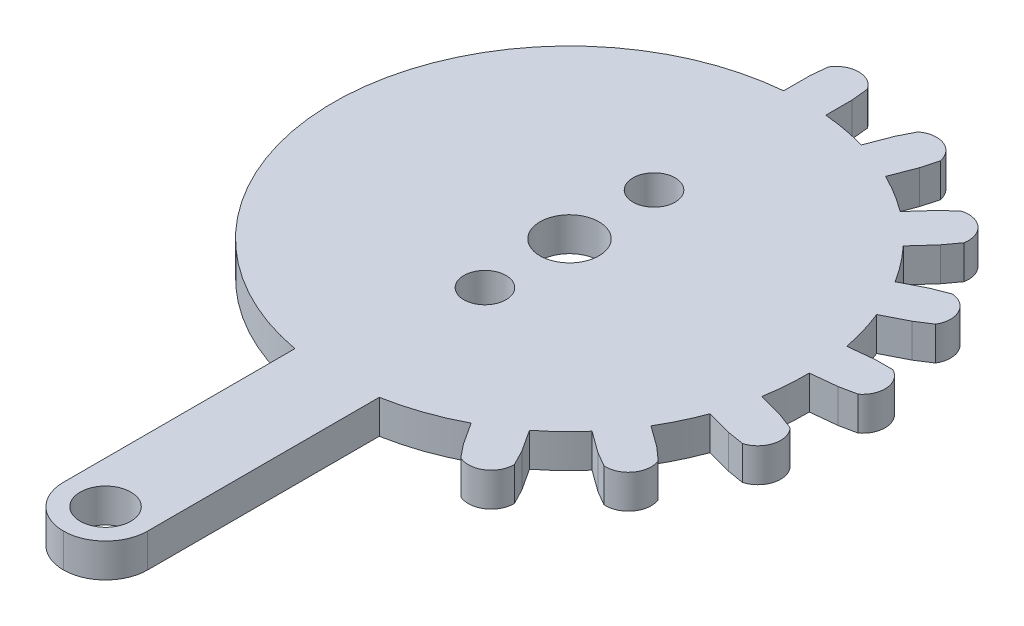
from build123d import *

# Parameters (mm, degrees)
BOSS_EXTRUDE1_DEPTH = 1
SKETCH5_R           = 1.75
SKETCH5_R_2         = 1.25
CUT_EXTRUDE3_DEPTH  = 35.568104475
FILLET1_R           = 2.5
SKETCH6_R           = 1.5
CUT_EXTRUDE4_DEPTH  = 35.568104475


with BuildPart() as part:
    # Sketch1 → Boss-Extrude1 (new, symmetric)
    with BuildSketch(Plane(origin=(0, 0, 0), x_dir=(1, 0, 0), z_dir=(0, 1, 0))):
        with BuildLine():
            Line((1.25, 15.5), (1.15, 16.5))
            ThreePointArc((1.15, 16.5), (0, 17.143895929), (-1.15, 16.5))
            Line((-1.15, 16.5), (-1.25, 15.5))
            Line((-1.25, 15.5), (-1.25, 13.944084767))
            ThreePointArc((-1.25, 13.944084767), (-13.985786559, 0.630693533), (-2.5, -13.774977314))
            Line((-2.5, -13.774977314), (-2.5, -30))
            Line((-2.5, -30), (2.5, -30))
            Line((2.5, -30), (2.5, -13.774977314))
            ThreePointArc((2.5, -13.774977314), (4.576899397, -13.230721519), (6.546154662, -12.375292285))
            Line((6.546154662, -12.375292285), (7.393566833, -13.680192597))
            Line((7.393566833, -13.680192597), (8.022072925, -14.464399261))
            ThreePointArc((8.022072925, -14.464399261), (9.337234935, -14.378080935), (9.951015231, -13.211729481))
            Line((9.951015231, -13.211729481), (9.490243253, -12.318595009))
            Line((9.490243253, -12.318595009), (8.642831082, -11.013694698))
            ThreePointArc((8.642831082, -11.013694698), (9.63696406, -10.155241194), (10.546269982, -9.207398626))
            Line((10.546269982, -9.207398626), (11.805031847, -10.121942654))
            Line((11.805031847, -10.121942654), (12.672827367, -10.628826206))
            ThreePointArc((12.672827367, -10.628826206), (13.869703156, -10.076929194), (14.024733447, -8.768087119))
            Line((14.024733447, -8.768087119), (13.274494978, -8.099400168))
            Line((13.274494978, -8.099400168), (12.015733113, -7.18485614))
            ThreePointArc((12.015733113, -7.18485614), (12.636193981, -6.027155355), (13.145427794, -4.816401987))
            Line((13.145427794, -4.816401987), (14.648326501, -5.219102482))
            Line((14.648326501, -5.219102482), (15.640134232, -5.381328944))
            ThreePointArc((15.640134232, -5.381328944), (16.559731841, -4.437166774), (16.235418036, -3.159699544))
            Line((16.235418036, -3.159699544), (15.295374114, -2.804287916))
            Line((15.295374114, -2.804287916), (13.792475407, -2.401587421))
            ThreePointArc((13.792475407, -2.401587421), (13.956842672, -1.09842734), (13.998358191, 0.214401383))
            Line((13.998358191, 0.214401383), (15.545749957, 0.377038811))
            Line((15.545749957, 0.377038811), (16.529819006, 0.581019464))
            ThreePointArc((16.529819006, 0.581019464), (17.049979873, 1.792025096), (16.289403541, 2.868419824))
            Line((16.289403541, 2.868419824), (15.284428799, 2.86334355))
            Line((15.284428799, 2.86334355), (13.737037033, 2.700706122))
            ThreePointArc((13.737037033, 2.700706122), (13.423476288, 3.976214826), (12.991758626, 5.216723857))
            Line((12.991758626, 5.216723857), (14.37808925, 5.923094591))
            Line((14.37808925, 5.923094591), (15.223696724, 6.466185743))
            ThreePointArc((15.223696724, 6.466185743), (15.275323122, 7.78316588), (14.179518574, 8.515500749))
            Line((14.179518574, 8.515500749), (13.243113, 8.150610901))
            Line((13.243113, 8.150610901), (11.856782377, 7.444240167))
            ThreePointArc((11.856782377, 7.444240167), (11.106946764, 8.522660006), (10.259344927, 9.526061183))
            Line((10.259344927, 9.526061183), (11.30045543, 10.682331537))
            Line((11.30045543, 10.682331537), (11.895271554, 11.492389423))
            ThreePointArc((11.895271554, 11.492389423), (11.471505478, 12.740397548), (10.186038456, 13.031389818))
            Line((10.186038456, 13.031389818), (9.442593367, 12.355158053))
            Line((9.442593367, 12.355158053), (8.401482864, 11.198887699))
            ThreePointArc((8.401482864, 11.198887699), (7.314979906, 11.936962301), (6.164088599, 12.569964667))
            Line((6.164088599, 12.569964667), (6.721678751, 14.022536674))
            Line((6.721678751, 14.022536674), (6.986688658, 14.991953895))
            ThreePointArc((6.986688658, 14.991953895), (6.143822831, 16.005205673), (4.839453677, 15.816200179))
            Line((4.839453677, 15.816200179), (4.387727685, 14.918456548))
            Line((4.387727685, 14.918456548), (3.830137533, 13.465884541))
            ThreePointArc((3.830137533, 13.465884541), (2.551297357, 13.765568706), (1.25, 13.944084767))
            Line((1.25, 13.944084767), (1.25, 15.5))
        make_face()
    extrude(amount=BOSS_EXTRUDE1_DEPTH, both=True)

    # Sketch5 → Cut-Extrude3 (cut, through all)
    with BuildSketch(Plane(origin=(0, 1, 0), x_dir=(1, 0, 0), z_dir=(0, 1, 0))):
        with Locations(Location((0, 0, 0), (0, 0, 270))):
            Circle(SKETCH5_R)
        with Locations(Location((0, 5.011164895, 0), (0, 0, 270))):
            Circle(SKETCH5_R_2)
        with Locations(Location((0, -5.011164895, 0), (0, 0, 90))):
            Circle(SKETCH5_R_2)
    extrude(amount=-CUT_EXTRUDE3_DEPTH, mode=Mode.SUBTRACT)

    # Fillet1
    fillet1_edges = [part.edges().sort_by_distance(p)[0] for p in [
        (-2.5, 0, 30),
        (2.5, 0, 30),
    ]]
    fillet(fillet1_edges, radius=FILLET1_R - 0.0001)  # a hair under: the kernel refuses the full size

    # Sketch6 → Cut-Extrude4 (cut, through all)
    with BuildSketch(Plane(origin=(0, 1, 0), x_dir=(1, 0, 0), z_dir=(0, 1, 0))):
        with Locations(Location((0, -27.5, 0), (0, 0, 270))):
            Circle(SKETCH6_R)
    extrude(amount=-CUT_EXTRUDE4_DEPTH, mode=Mode.SUBTRACT)


solid = part.part
